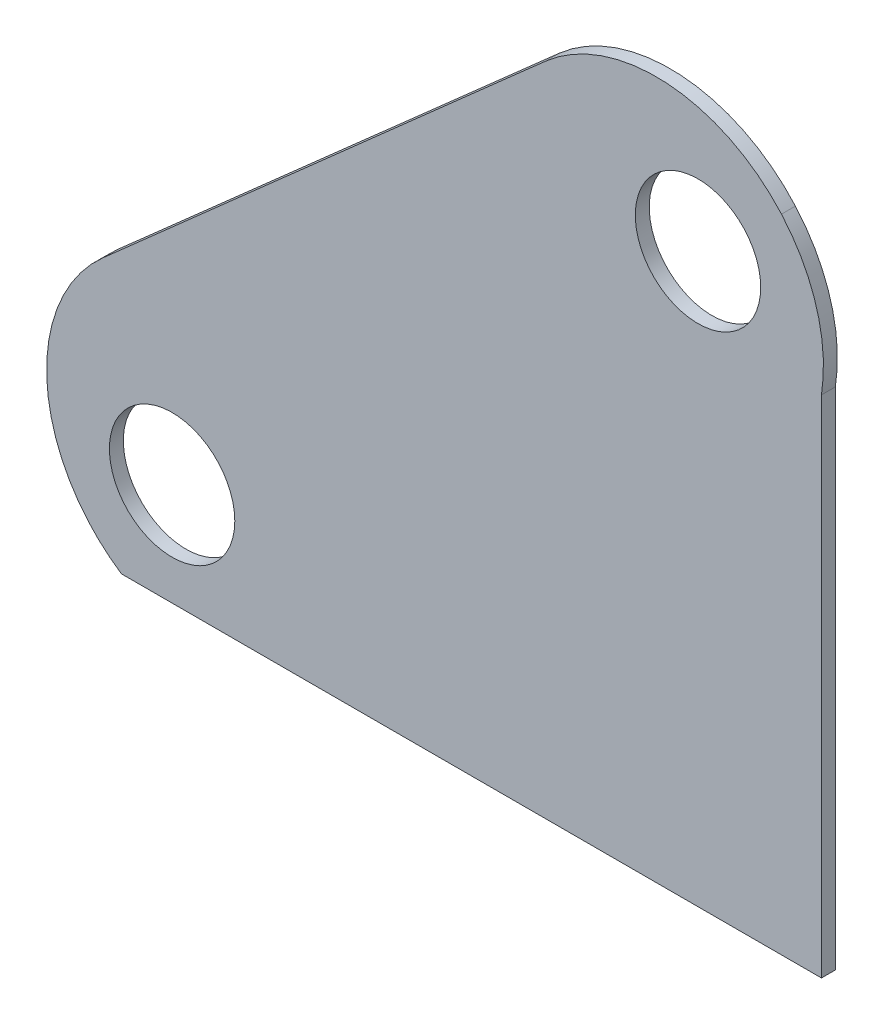
from build123d import *

# Parameters (mm, degrees)
BOSS_EXTRUDE1_DEPTH = 3.175
FILLET1_R           = 38.1
SKETCH2_W           = 42.672654426
SKETCH2_H           = 6.35
CUT_EXTRUDE1_DEPTH  = 3.175
BOSS_EXTRUDE2_DEPTH = 3.175


with BuildPart() as part:
    # Sketch1 → Boss-Extrude1 (new body)
    with BuildSketch(Plane.XY):
        with BuildLine():
            Line((-221.658355151, 4.726030951), (-123.220415709, 91.814619456))
            ThreePointArc((-123.220415709, 91.814619456), (-126.780447272, 102.154073831), (-121.98667143, 111.982494593))
            Line((-121.98667143, 111.982494593), (-137.765113811, 129.81717744))
            Line((-137.765113811, 129.81717744), (-257.60467267, 23.794458078))
            Line((-257.60467267, 23.794458078), (-241.826230288, 5.95977523))
            ThreePointArc((-241.826230288, 5.95977523), (-231.486775913, 9.519806794), (-221.658355151, 4.726030951))
        make_face()
        with BuildLine():
            Line((-207.113657049, -33.276527034), (-87.274098191, 72.746192329))
            Line((-87.274098191, 72.746192329), (-103.052540572, 90.580875176))
            ThreePointArc((-103.052540572, 90.580875176), (-113.391994947, 87.020843613), (-123.220415709, 91.814619456))
            Line((-123.220415709, 91.814619456), (-221.658355151, 4.726030951))
            ThreePointArc((-221.658355151, 4.726030951), (-218.998392521, 0.320824743), (-218.071664859, -4.741034478))
            ThreePointArc((-218.071664859, -4.741034478), (-219.332397157, -10.60925222), (-222.892099431, -15.441844187))
            Line((-222.892099431, -15.441844187), (-207.113657049, -33.276527034))
        make_face()
        with BuildLine():
            Line((-226.137318753, -50.106865574), (-207.113657049, -33.276527034))
            Line((-207.113657049, -33.276527034), (-222.892099431, -15.441844187))
            ThreePointArc((-222.892099431, -15.441844187), (-233.231553806, -19.00187575), (-243.059974568, -14.208099907))
            Line((-243.059974568, -14.208099907), (-251.382826563, -21.571373018))
            Line((-251.382826563, -21.571373018), (-226.137318753, -50.106865574))
        make_face()
        with BuildLine():
            Line((-251.382826563, -21.571373018), (-243.059974568, -14.208099907))
            ThreePointArc((-243.059974568, -14.208099907), (-246.620006131, -3.868645532), (-241.826230288, 5.95977523))
            Line((-241.826230288, 5.95977523), (-257.60467267, 23.794458078))
            Line((-257.60467267, 23.794458078), (-276.628334373, 6.964119538))
            Line((-276.628334373, 6.964119538), (-251.382826563, -21.571373018))
        make_face()
        with BuildLine():
            Line((-101.818796292, 110.748750313), (-93.495944297, 118.112023425))
            Line((-93.495944297, 118.112023425), (-118.741452107, 146.647515981))
            Line((-118.741452107, 146.647515981), (-137.765113811, 129.81717744))
            Line((-137.765113811, 129.81717744), (-121.98667143, 111.982494593))
            ThreePointArc((-121.98667143, 111.982494593), (-111.647217054, 115.542526156), (-101.818796292, 110.748750313))
        make_face()
        with BuildLine():
            Line((-103.052540572, 90.580875176), (-87.274098191, 72.746192329))
            Line((-87.274098191, 72.746192329), (-68.250436487, 89.576530869))
            Line((-68.250436487, 89.576530869), (-93.495944297, 118.112023425))
            Line((-93.495944297, 118.112023425), (-101.818796292, 110.748750313))
            ThreePointArc((-101.818796292, 110.748750313), (-99.158833662, 106.343544105), (-98.232106001, 101.281684885))
            ThreePointArc((-98.232106001, 101.281684885), (-99.492838298, 95.413467143), (-103.052540572, 90.580875176))
        make_face()
    extrude(amount=BOSS_EXTRUDE1_DEPTH)

    # Fillet1
    fillet1_edges = [part.edges().sort_by_distance(p)[0] for p in [
        (-276.628334373, 6.964119538, 1.5875),
        (-226.137318753, -50.106865574, 1.5875),
        (-68.250436487, 89.576530869, 1.5875),
        (-118.741452107, 146.647515981, 1.5875),
    ]]
    fillet(fillet1_edges, radius=FILLET1_R - 0.0001)  # a hair under: the kernel refuses the full size

    # Sketch2 → Cut-Extrude1 (cut)
    with BuildSketch(Plane.XY.offset(3.175)):
        with Locations((-222.571574213, -31.250865208)):
            Rectangle(SKETCH2_W, SKETCH2_H)
    extrude(amount=-CUT_EXTRUDE1_DEPTH, mode=Mode.SUBTRACT)


with BuildPart() as cut_extrude1_kept_piece:
    # of the separate pieces the step leaves, the one the design keeps (cut_extrude1_pieces_kept)
    add(part.part.solids().sort_by_distance((-251.382760302, -21.571447914, 0))[0])

    # Sketch3 → Boss-Extrude2 (add)
    with BuildSketch(Plane.XY.offset(3.175)):
        with BuildLine():
            Line((-84.386706387, -28.075865208), (-84.386706387, 86.994184885))
            ThreePointArc((-84.386706387, 86.994184885), (-88.606891327, 74.579641731), (-96.785929043, 64.331023059))
            Line((-96.785929043, 64.331023059), (-197.601826197, -24.861357764))
            ThreePointArc((-197.601826197, -24.861357764), (-199.63857671, -26.541152476), (-201.786766589, -28.075865208))
            Line((-201.786766589, -28.075865208), (-84.386706387, -28.075865208))
        make_face()
    extrude(amount=-BOSS_EXTRUDE2_DEPTH)


solid = cut_extrude1_kept_piece.part
